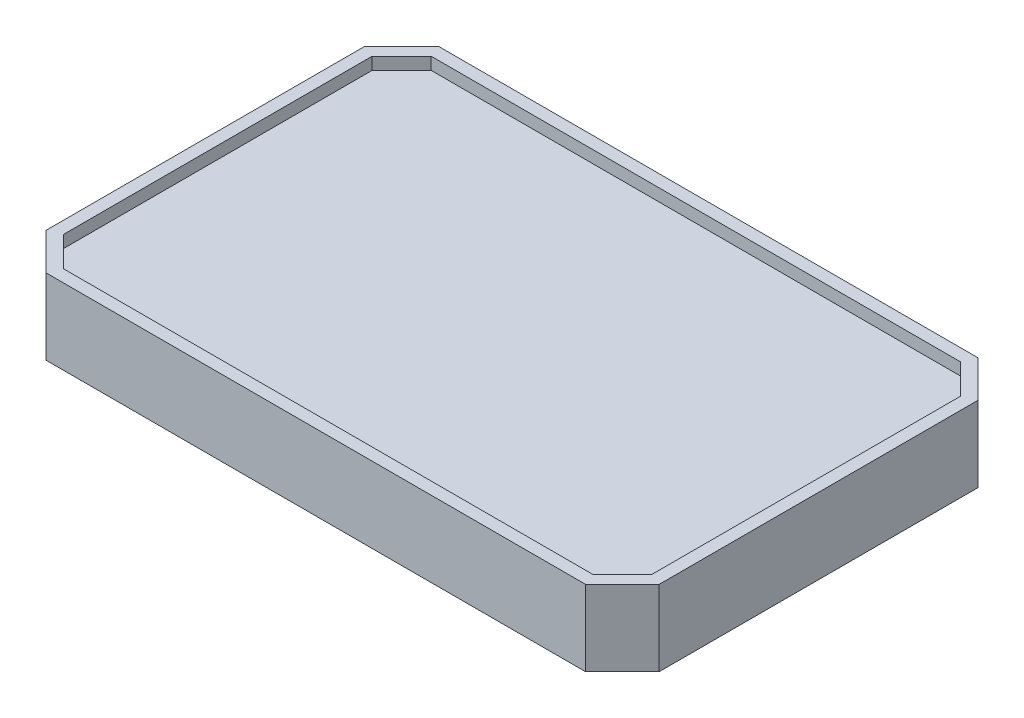
from build123d import *

# Parameters (mm, degrees)
ESBO_O1_W        = 5
ESBO_O1_H        = 3.2
EXTRUS_O1_DEPTH  = 0.617
CHANFRO3_SIZE    = 0.3
CHANFRO4_SIZE    = 0.3
CHANFRO5_SIZE    = 0.3
CHANFRO6_SIZE    = 0.3
EXTRUS_O6_DEPTH  = 0.1
EXTRUS_O8_DEPTH  = 0.1
EXTRUS_O9_DEPTH  = 0.1
EXTRUS_O13_DEPTH = 0.1
EXTRUS_O14_DEPTH = 0.1


with BuildPart() as part:
    # Esboço1 → Extrusão1 (new body)
    with BuildSketch(Plane(origin=(0, 0, 0), x_dir=(1, 0, 0), z_dir=(0, 1, 0))):
        Rectangle(ESBO_O1_W, ESBO_O1_H)
    extrude(amount=EXTRUS_O1_DEPTH)

    # Chanfro3
    chanfro3_edges = [part.edges().sort_by_distance(p)[0] for p in [
        (2.5, 0.3085, 1.6),
    ]]
    chamfer(chanfro3_edges, length=CHANFRO3_SIZE)

    # Chanfro4
    chanfro4_edges = [part.edges().sort_by_distance(p)[0] for p in [
        (-2.5, 0.3085, 1.6),
    ]]
    chamfer(chanfro4_edges, length=CHANFRO4_SIZE)

    # Chanfro5
    chanfro5_edges = [part.edges().sort_by_distance(p)[0] for p in [
        (2.5, 0.3085, -1.6),
    ]]
    chamfer(chanfro5_edges, length=CHANFRO5_SIZE)

    # Chanfro6
    chanfro6_edges = [part.edges().sort_by_distance(p)[0] for p in [
        (-2.5, 0.3085, -1.6),
    ]]
    chamfer(chanfro6_edges, length=CHANFRO6_SIZE)

    # Esboço4 → Extrusão6 (cut)
    with BuildSketch(Plane(origin=(0, 0, 0), x_dir=(1, 0, 0), z_dir=(0, 1, 0))):
        Polygon((1.25, 0.75), (1.25, 1.55), (2.179289322, 1.55), (2.45, 1.279289322), (2.45, 0.75), align=None)
    extrude(amount=EXTRUS_O6_DEPTH, mode=Mode.SUBTRACT)

    # Esboço6 → Extrusão8 (cut)
    with BuildSketch(Plane(origin=(0, 0, 0), x_dir=(1, 0, 0), z_dir=(0, 1, 0))):
        Polygon((1.25, -1.55), (1.25, -0.75), (2.45, -0.75), (2.45, -1.279289322), (2.179289322, -1.55), align=None)
    extrude(amount=EXTRUS_O8_DEPTH, mode=Mode.SUBTRACT)

    # Esboço7 → Extrusão9 (cut)
    with BuildSketch(Plane(origin=(0, 0, 0), x_dir=(1, 0, 0), z_dir=(0, 1, 0))):
        Polygon((-2.45, -0.75), (-1.518700577, -0.75), (-1.25, -1.018700577), (-1.25, -1.55), (-2.179289322, -1.55), (-2.45, -1.279289322), align=None)
    extrude(amount=EXTRUS_O9_DEPTH, mode=Mode.SUBTRACT)

    # Esboço10 → Extrusão13 (cut)
    with BuildSketch(Plane(origin=(0, 0.617, 0), x_dir=(1, 0, 0), z_dir=(0, 1, 0))):
        Polygon((-2.4, 1.258578644), (-2.158578644, 1.5), (2.158578644, 1.5), (2.4, 1.258578644), (2.4, -1.258578644), (2.158578644, -1.5), (-2.158578644, -1.5), (-2.4, -1.258578644), align=None)
    extrude(amount=-EXTRUS_O13_DEPTH, mode=Mode.SUBTRACT)

    # Esboço11 → Extrusão14 (cut)
    with BuildSketch(Plane(origin=(0, 0, 0), x_dir=(1, 0, 0), z_dir=(0, 1, 0))):
        Polygon((-2.45, 1.279289322), (-2.45, 0.75), (-1.25, 0.75), (-1.25, 1.55), (-2.179289322, 1.55), align=None)
    extrude(amount=EXTRUS_O14_DEPTH, mode=Mode.SUBTRACT)


solid = part.part
